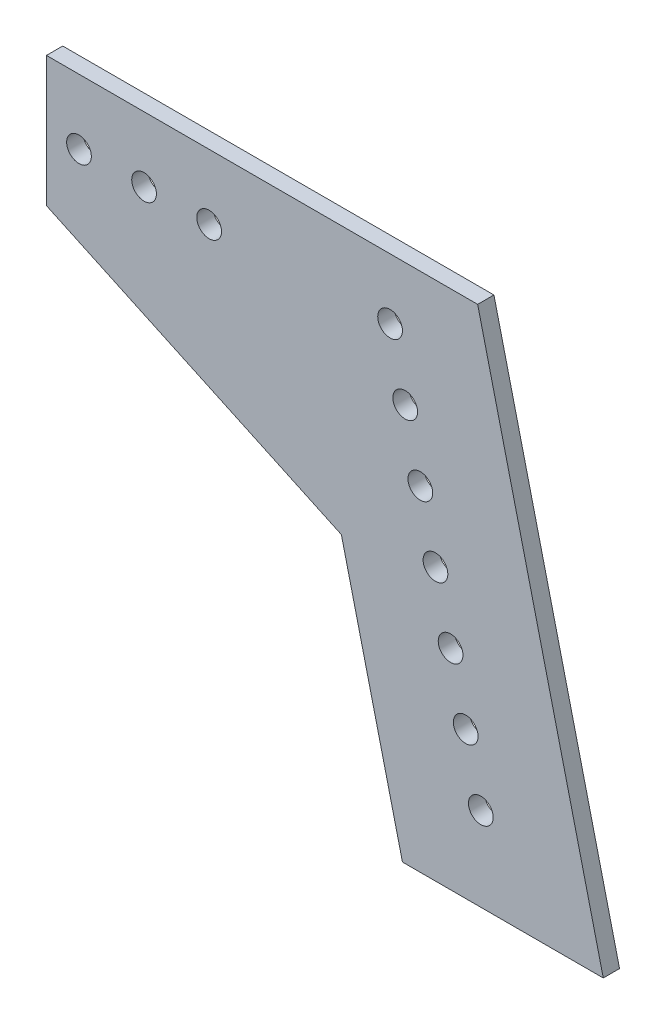
from build123d import *

# Parameters (mm, degrees)
SKETCH1_W           = 381
SKETCH1_H           = 177.8
BOSS_EXTRUDE1_DEPTH = 3.175
CUT_EXTRUDE1_DEPTH  = 211.246380766
CUT_EXTRUDE2_DEPTH  = 211.246380766
CUT_EXTRUDE3_DEPTH  = 211.246380766
SKETCH9_R           = 2.413
CUT_EXTRUDE5_DEPTH  = 203.001417807
CUT_EXTRUDE6_DEPTH  = 203.001417807
CUT_EXTRUDE7_DEPTH  = 193.181197821
SKETCH12_R          = 2.413
CUT_EXTRUDE8_DEPTH  = 151.259355372


with BuildPart() as part:
    # Sketch1 → Boss-Extrude1 (new body)
    with BuildSketch(Plane.XY):
        Rectangle(SKETCH1_W, SKETCH1_H)
    extrude(amount=BOSS_EXTRUDE1_DEPTH)

    # Sketch3 → Cut-Extrude1 (cut, through all)
    with BuildSketch(Plane(origin=(0, 0, 0), x_dir=(-1, 0, 0), z_dir=(0, 0, -1))):
        Polygon((-190.5, 88.9), (-99.370844133, 88.9), (-190.5, -288.755692733), align=None)
        Polygon((258.630794567, 88.9), (156.501034435, 88.9), (258.630794567, -334.344185132), align=None)
    extrude(amount=-CUT_EXTRUDE1_DEPTH, mode=Mode.SUBTRACT)

    # Sketch4 → Cut-Extrude2 (cut, through all)
    with BuildSketch(Plane(origin=(0, 0, 0), x_dir=(-1, 0, 0), z_dir=(0, 0, -1))):
        Polygon((201.948976875, -63.5), (-149.057902373, -63.5), (-154.480371301, -88.9), (207.162724281, -88.9), align=None)
    extrude(amount=-CUT_EXTRUDE2_DEPTH, mode=Mode.SUBTRACT)

    # Sketch8 → Cut-Extrude3 (cut, through all)
    with BuildSketch(Plane(origin=(0, 0, 0), x_dir=(-1, 0, 0), z_dir=(0, 0, -1))):
        Polygon((-96.951775135, -63.5), (-85.032410439, -14.118133437), (194.367589561, -14.118133437), (206.286954257, -63.5), align=None)
    extrude(amount=-CUT_EXTRUDE3_DEPTH, mode=Mode.SUBTRACT)

    # Sketch9 → Cut-Extrude5 (cut, through all)
    with BuildSketch(Plane(origin=(0, 0, 0), x_dir=(-1, 0, 0), z_dir=(0, 0, -1))):
        with Locations((-112.24886681, -47.11699111)):
            Circle(SKETCH9_R)
        with Locations((-109.296836647, -34.883244559)):
            Circle(SKETCH9_R)
        with Locations((-106.344806484, -22.649498008)):
            Circle(SKETCH9_R)
        with Locations((-103.39277632, -10.415751457)):
            Circle(SKETCH9_R)
        with Locations((-100.440746157, 1.817995094)):
            Circle(SKETCH9_R)
        with Locations((-97.488715994, 14.051741645)):
            Circle(SKETCH9_R)
        with Locations((-94.53668583, 26.285488196)):
            Circle(SKETCH9_R)
        with Locations((-85.680595341, 62.986727849)):
            Circle(SKETCH9_R)
        with Locations((-82.728565177, 75.2204744)):
            Circle(SKETCH9_R)
    extrude(amount=-CUT_EXTRUDE5_DEPTH, mode=Mode.SUBTRACT)

    # Sketch10 → Cut-Extrude6 (cut, through all)
    with BuildSketch(Plane(origin=(0, 0, 0), x_dir=(-1, 0, 0), z_dir=(0, 0, -1))):
        Polygon((-99.370844133, 88.9), (-111.628996749, 38.1), (168.75918705, 38.1), (156.501034435, 88.9), align=None)
    extrude(amount=-CUT_EXTRUDE6_DEPTH, mode=Mode.SUBTRACT)

    # Sketch11 → Cut-Extrude7 (cut, through all)
    with BuildSketch(Plane(origin=(0, 0, 0), x_dir=(-1, 0, 0), z_dir=(0, 0, -1))):
        Polygon((-85.032410439, -14.118133437), (-27.473417058, 12.7), (-27.473417058, 38.1), (60.959223321, 38.1), (169.910337867, 38.1), (200.791231683, -67.495182141), (145.167714647, -67.495182141), (132.284027695, -14.118133437), align=None)
    extrude(amount=-CUT_EXTRUDE7_DEPTH, mode=Mode.SUBTRACT)

    # Sketch12 → Cut-Extrude8 (cut, through all)
    with BuildSketch(Plane(origin=(0, 0, 0), x_dir=(-1, 0, 0), z_dir=(0, 0, -1))):
        with Locations((-33.823417058, 25.4)):
            Circle(SKETCH12_R)
        with Locations((-46.523417058, 25.4)):
            Circle(SKETCH12_R)
        with Locations((-59.223417058, 25.4)):
            Circle(SKETCH12_R)
    extrude(amount=-CUT_EXTRUDE8_DEPTH, mode=Mode.SUBTRACT)


solid = part.part
